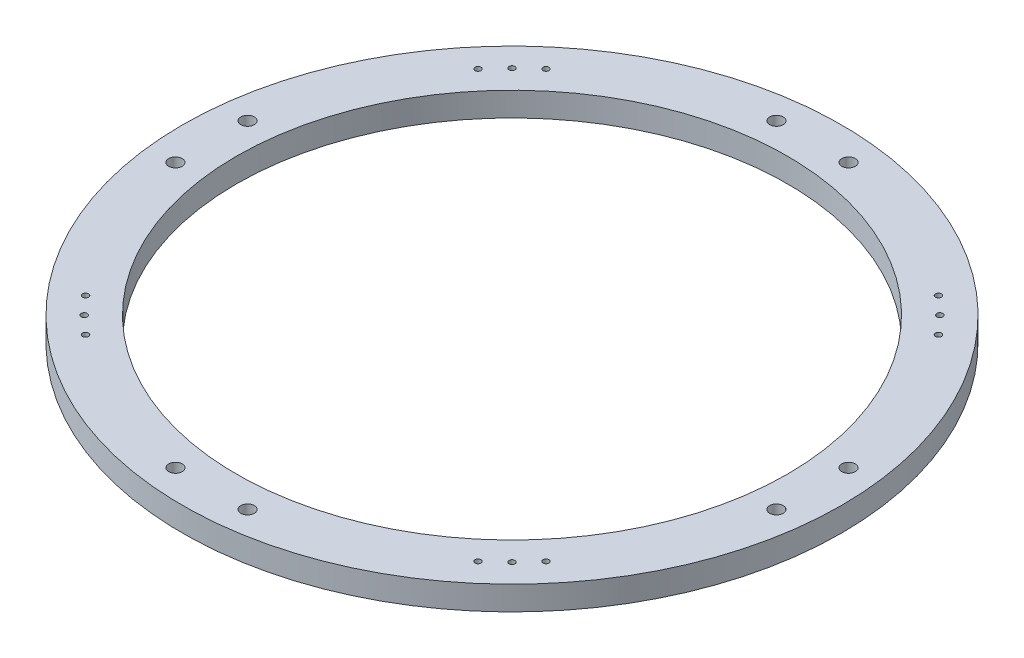
from build123d import *

# Parameters (mm, degrees)
SKETCH1_W                    = 28.575
SKETCH1_H                    = 12.7
F_1_8_0_125_DIAMETER_HOLE1_D = 3.175
SKETCH7_R                    = 3.571875
CUT_EXTRUDE1_DEPTH           = 247.543645639
CIRPATTERN1_COUNT            = 4


with BuildPart() as part:
    # Sketch1 → Revolve1 (revolve)
    with BuildSketch(Plane.XY):
        with Locations((159.813733777, 201.018503093)):
            Rectangle(SKETCH1_W, SKETCH1_H)
    revolve(axis=Axis((1e-09, -200000, 0), (0, 1, 0)))

    # 1/8 (0.125) Diameter Hole1 (through all)
    with Locations(Plane(origin=(0, 207.368503093, 0), x_dir=(1, 0, 0), z_dir=(0, 1, 0))):
        with Locations((-113.00537488, 113.00537488), (-103.667734326, 121.628246568), (-121.628246568, 103.667734326)):
            f_1_8_0_125_diameter_hole1 = Hole(F_1_8_0_125_DIAMETER_HOLE1_D / 2)

    # Sketch7 → Cut-Extrude1 (cut, through all)
    with BuildSketch(Plane(origin=(0, 207.368503093, 0), x_dir=(1, 0, 0), z_dir=(0, 1, 0))):
        with Locations((158.75, -19.05)):
            Circle(SKETCH7_R)
        with Locations((158.75, 19.05)):
            Circle(SKETCH7_R)
    cut_extrude1 = extrude(amount=-CUT_EXTRUDE1_DEPTH, mode=Mode.SUBTRACT)

    # CirPattern1: 1/8 (0.125) Diameter Hole1, Cut-Extrude1 ×4 about axis
    cirpattern1_axis = Axis((1e-09, -200000, 0), (0, -1, 0))
    add([f_1_8_0_125_diameter_hole1.rotate(cirpattern1_axis, i * 360 / CIRPATTERN1_COUNT) for i in range(1, CIRPATTERN1_COUNT)], mode=Mode.SUBTRACT)
    add([cut_extrude1.rotate(cirpattern1_axis, i * 360 / CIRPATTERN1_COUNT) for i in range(1, CIRPATTERN1_COUNT)], mode=Mode.SUBTRACT)


solid = part.part
